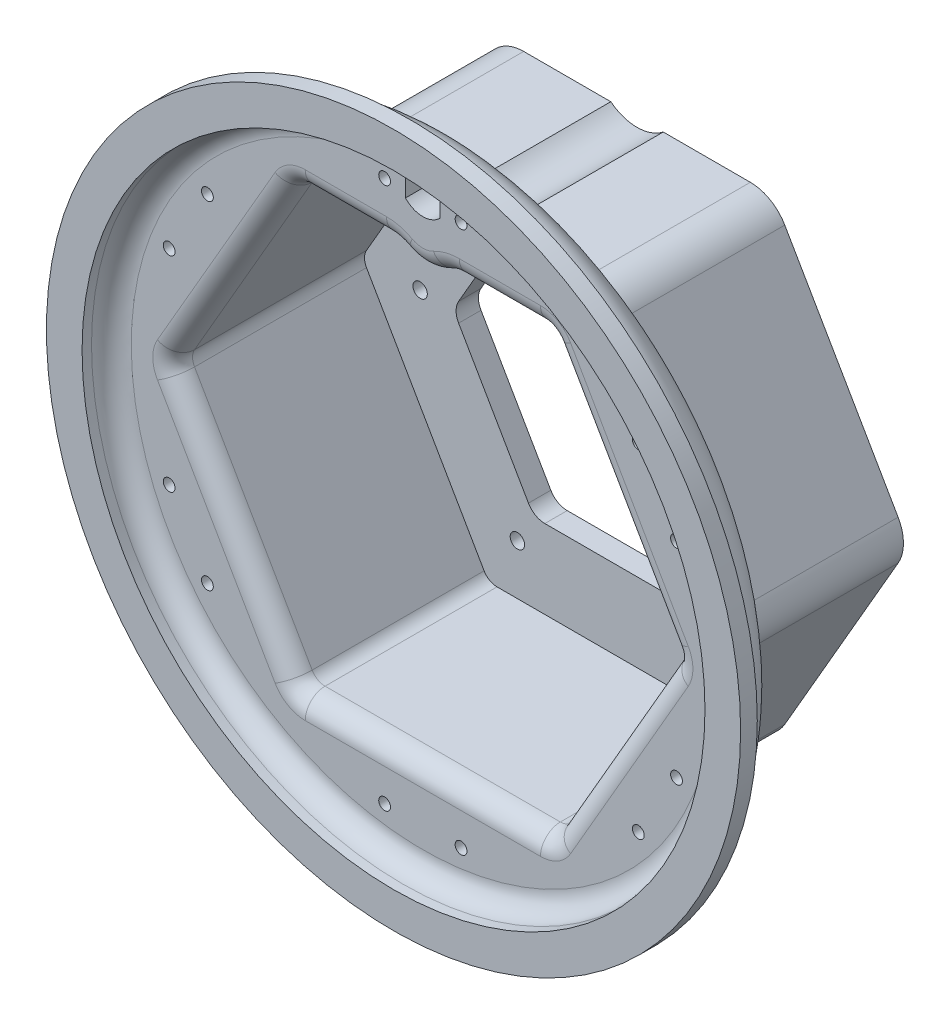
from build123d import *

# Parameters (mm, degrees)
BOSS_EXTRUDE1_DEPTH        = 65
BOSS_EXTRUDE2_START        = 9
BOSS_EXTRUDE2_DEPTH        = 9
SKETCH6_R                  = 132.3
BOSS_EXTRUDE3_DEPTH        = 12.2
CUT_EXTRUDE1_REACH         = 204.402
SKETCH3_R                  = 2.9
FILLET1_R                  = 7.62
FILLET2_R                  = 6
FILLET3_R                  = 14
FILLET6_R                  = 14
SKETCH12_R                 = 131.85493252
SKETCH12_R_2               = 125.35493252
BOSS_EXTRUDE5_DEPTH        = 5.1
SKETCH13_R                 = 139.7
SKETCH13_R_2               = 125.35493252
BOSS_EXTRUDE7_DEPTH        = 6.7
FILLET7_R                  = 8
FILLET8_R                  = 4
FILLET9_R                  = 8
CUT_EXTRUDE2_DEPTH         = 211.969618666
CIRPATTERN1_COUNT          = 6
FILLET11_R                 = 16
FILLET10_R                 = 4
STAR_START                 = -6.477
STAR_HUB_Y_END_OUTLINE_R   = 2.375
STAR_HUB_Y_END_OUTLINE_R_2 = 2.5908
STAR_HUB_Y_END_OUTLINE_R_3 = 14.5288
STAR_HUB_Y_END_DEPTH       = 9.525
BODY_MOVE_COPY2_ANGLE      = 93.8409657
SKETCH18_R                 = 2.375
CUT_EXTRUDE3_DEPTH         = 12.2
CIRPATTERN2_COUNT          = 6


with BuildPart() as part:
    # Sketch1 → Boss-Extrude1 (new body)
    with BuildSketch(Plane.XY):
        with BuildLine():
            Line((109.696551146, 0), (54.848275573, 95))
            Line((54.848275573, 95), (10.560528181, 95))
            ThreePointArc((10.560528181, 95), (0, 91.321983506), (-10.560528181, 95))
            Line((-10.560528181, 95), (-54.848275573, 95))
            Line((-54.848275573, 95), (-109.696551146, 0))
            Line((-109.696551146, 0), (-54.848275573, -95))
            Line((-54.848275573, -95), (54.848275573, -95))
            Line((54.848275573, -95), (109.696551146, 0))
        make_face()
        with BuildLine():
            Line((101.613647377, 0), (50.806823689, 88))
            Line((50.806823689, 88), (10.560528181, 88))
            ThreePointArc((10.560528181, 88), (0, 84.321983506), (-10.560528181, 88))
            Line((-10.560528181, 88), (-50.806823689, 88))
            Line((-50.806823689, 88), (-101.613647377, 0))
            Line((-101.613647377, 0), (-50.806823689, -88))
            Line((-50.806823689, -88), (50.806823689, -88))
            Line((50.806823689, -88), (101.613647377, 0))
        make_face(mode=Mode.SUBTRACT)
    extrude(amount=BOSS_EXTRUDE1_DEPTH)

    # Sketch2 → Boss-Extrude2 (add)
    with BuildSketch(Plane(origin=(0, 0, 0), x_dir=(-1, 0, 0), z_dir=(0, 0, -1)).offset(BOSS_EXTRUDE2_START)):
        with BuildLine():
            Line((109.696551146, 0), (54.848275573, 95))
            Line((54.848275573, 95), (10.560528181, 95))
            ThreePointArc((10.560528181, 95), (0, 91.321983506), (-10.560528181, 95))
            Line((-10.560528181, 95), (-54.848275573, 95))
            Line((-54.848275573, 95), (-109.696551146, 0))
            Line((-109.696551146, 0), (-54.848275573, -95))
            Line((-54.848275573, -95), (54.848275573, -95))
            Line((54.848275573, -95), (109.696551146, 0))
        make_face()
        Polygon((65, 0), (32.5, 56.291651246), (-32.5, 56.291651246), (-65, 0), (-32.5, -56.291651246), (32.5, -56.291651246), align=None, mode=Mode.SUBTRACT)
    extrude(amount=-BOSS_EXTRUDE2_DEPTH)

    # Sketch6 → Boss-Extrude3 (add)
    with BuildSketch(Plane.XY.offset(65)):
        Circle(SKETCH6_R)
        with BuildLine():
            Line((101.613647377, 0), (50.806823689, 88))
            Line((50.806823689, 88), (10.560528181, 88))
            ThreePointArc((10.560528181, 88), (0, 84.321983506), (-10.560528181, 88))
            Line((-10.560528181, 88), (-50.806823689, 88))
            Line((-50.806823689, 88), (-101.613647377, 0))
            Line((-101.613647377, 0), (-50.806823689, -88))
            Line((-50.806823689, -88), (50.806823689, -88))
            Line((50.806823689, -88), (101.613647377, 0))
        make_face(mode=Mode.SUBTRACT)
    extrude(amount=BOSS_EXTRUDE3_DEPTH)

    # Sketch3 → Cut-Extrude1 (cut, up to next)
    with BuildSketch(Plane.XY, mode=Mode.PRIVATE) as cut_extrude1_sk1:
        with Locations((78.3, 0)):
            Circle(SKETCH3_R)
    cut_extrude1_tool1 = extrude(cut_extrude1_sk1.sketch, amount=-CUT_EXTRUDE1_REACH, mode=Mode.PRIVATE) & part.part
    cut_extrude1 = cut_extrude1_tool1.solids().sort_by_distance((78.3, 0, 0))[0]
    add(cut_extrude1, mode=Mode.SUBTRACT)

    # Fillet1
    fillet1_edges = [part.edges().sort_by_distance(p)[0] for p in [
        (-65, 0, -4.5),
        (-32.5, 56.291651246, -4.5),
        (32.5, 56.291651246, -4.5),
        (65, 0, -4.5),
        (32.5, -56.291651246, -4.5),
        (-32.5, -56.291651246, -4.5),
    ]]
    fillet(fillet1_edges, radius=FILLET1_R)

    # Fillet2
    fillet2_edges = [part.edges().sort_by_distance(p)[0] for p in [
        (50.806823689, -88, 38.6),
        (101.613647377, 0, 38.6),
        (50.806823689, 88, 38.6),
        (-50.806823689, 88, 38.6),
        (-101.613647377, 0, 38.6),
        (-50.806823689, -88, 38.6),
    ]]
    fillet(fillet2_edges, radius=FILLET2_R)

    # Fillet3
    fillet3_edges = [part.edges().sort_by_distance(p)[0] for p in [
        (10.560528181, 88, 38.6),
        (-10.560528181, 88, 38.6),
    ]]
    fillet(fillet3_edges, radius=FILLET3_R)

    # Fillet6
    # the kernel refuses this fillet: 14 mm, written as the material it takes off along each edge
    with BuildSketch(Plane(origin=(0, 0, 65), x_dir=(1, 0, 0), z_dir=(0, -1, 0))) as fillet6_piece_1:
        with BuildLine():
            CenterArc((118.416196487, 14), FILLET6_R, 270, 82.612951564)
            Line((118.416196487, 0), (118.416196487, -0.28))
            Line((118.416196487, -0.28), (132.3, -0.28))
            Line((132.3, -0.28), (132.58, 0))
            ThreePointArc((132.58, 0), (132.58, 6.1), (132.57767607, 12.164))
            Line((132.57767607, 12.164), (132.3, 12.2))
        make_face()
    revolve(axis=Axis((0, 0, 65), (0, 0, 1)), mode=Mode.SUBTRACT)

    # Sketch12 → Boss-Extrude5 (add)
    with BuildSketch(Plane.XY.offset(77.2)):
        Circle(SKETCH12_R)
        Circle(SKETCH12_R_2, mode=Mode.SUBTRACT)
    extrude(amount=BOSS_EXTRUDE5_DEPTH)

    # Sketch13 → Boss-Extrude7 (add)
    with BuildSketch(Plane.XY.offset(82.3)):
        Circle(SKETCH13_R)
        Circle(SKETCH13_R_2, mode=Mode.SUBTRACT)
    extrude(amount=BOSS_EXTRUDE7_DEPTH)

    # Fillet7
    fillet7_edges = [part.edges().sort_by_distance(p)[0] for p in [
        (-125.35493252, 0, 77.2),
    ]]
    fillet(fillet7_edges, radius=FILLET7_R)

    # Fillet8
    fillet8_edges = [part.edges().sort_by_distance(p)[0] for p in [
        (-131.85493252, 0, 82.3),
    ]]
    fillet(fillet8_edges, radius=FILLET8_R)

    # Fillet9
    fillet9_edges = [part.edges().sort_by_distance(p)[0] for p in [
        (-76.210235533, -44, 77.2),
        (0, -88, 77.2),
        (76.210235533, -44, 77.2),
        (76.210235533, 44, 77.2),
        (30.994427629, 88, 77.2),
        (-76.210235533, 44, 77.2),
        (-50.342722074, -87.196152423, 77.2),
        (50.342722074, -87.196152423, 77.2),
        (100.685444147, 0, 77.2),
        (50.342722074, 87.196152423, 77.2),
        (-50.342722074, 87.196152423, 77.2),
        (-100.685444147, 0, 77.2),
        (0, 84.321983506, 77.2),
        (-30.994427629, 88, 77.2),
        (11.236253723, 87.578391733, 77.2),
        (-11.236253723, 87.578391733, 77.2),
    ]]
    fillet(fillet9_edges, radius=FILLET9_R)

    # Sketch9 → Cut-Extrude2 (cut, through all)
    with BuildSketch(Plane(origin=(0, 0, 65), x_dir=(-1, 0, 0), z_dir=(0, 0, -1))):
        with BuildLine():
            Line((7, 106.321983506), (7, 119.321983506))
            ThreePointArc((7, 119.321983506), (0, 122.321983506), (-7, 119.321983506))
            Line((-7, 119.321983506), (-7, 106.321983506))
            ThreePointArc((-7, 106.321983506), (0, 103.321983506), (7, 106.321983506))
        make_face()
    extrude(amount=-CUT_EXTRUDE2_DEPTH, mode=Mode.SUBTRACT)

    # CirPattern1: Cut-Extrude1 ×6 about axis
    cirpattern1_axis = Axis((0, 0, 0), (0, 0, 1))
    for i in range(1, CIRPATTERN1_COUNT):
        add(cut_extrude1.rotate(cirpattern1_axis, i * 360 / CIRPATTERN1_COUNT), mode=Mode.SUBTRACT)

    # Fillet11
    fillet11_edges = [part.edges().sort_by_distance(p)[0] for p in [
        (54.848275573, -95, 28),
        (-54.848275573, -95, 28),
        (-109.696551146, 0, 28),
        (-54.848275573, 95, 28),
        (54.848275573, 95, 28),
        (109.696551146, 0, 28),
    ]]
    fillet(fillet11_edges, radius=FILLET11_R)

    # Fillet10
    fillet10_edges = [part.edges().sort_by_distance(p)[0] for p in [
        (0, 91.321983506, 65),
        (-28.085599723, 95, 65),
        (-82.27241336, -47.5, 65),
        (-82.27241336, 47.5, 65),
        (28.085599723, 95, 65),
        (82.27241336, 47.5, 65),
        (82.27241336, -47.5, 65),
        (0, -95, 65),
        (-107.221342532, 0, 65),
        (-53.610671266, 92.856406461, 65),
        (53.610671266, 92.856406461, 65),
        (107.221342532, 0, 65),
        (53.610671266, -92.856406461, 65),
        (-53.610671266, -92.856406461, 65),
    ]]
    fillet(fillet10_edges, radius=FILLET10_R)

    # Sketch18 → Cut-Extrude3 (cut)
    with BuildSketch(Plane(origin=(0, 0, 65), x_dir=(-1, 0, 0), z_dir=(0, 0, -1))):
        with Locations((-15.376952006, 109.00535553)):
            Circle(SKETCH18_R)
        with Locations((15.376952006, 109.00535553)):
            Circle(SKETCH18_R)
    cut_extrude3 = extrude(amount=-CUT_EXTRUDE3_DEPTH, mode=Mode.SUBTRACT)

    # CirPattern2: Cut-Extrude3 ×6 about axis
    cirpattern2_axis = Axis((0, 0, 0), (0, 0, 1))
    for i in range(1, CIRPATTERN2_COUNT):
        add(cut_extrude3.rotate(cirpattern2_axis, i * 360 / CIRPATTERN2_COUNT), mode=Mode.SUBTRACT)


with BuildPart() as body_2:
    # Star Hub Y end: read off the stored shape, not the designer's step
    # Star Hub Y end outline → Star Hub Y end (new body)
    with BuildSketch(Plane(origin=(0, 0, 0), x_dir=(1, 0, 0), z_dir=(0, 1, 0)).offset(STAR_START)):
        with BuildLine():
            Line((107.56890983, 20.737840341), (72.569009092, 11.359645204))
            ThreePointArc((72.569009092, 11.359645204), (71.591417553, 11.165190156), (70.596807968, 11.1))
            Line((70.596807968, 11.1), (32.665578213, 11.1))
            ThreePointArc((32.665578213, 11.1), (25.817851007, 14.905943229), (25.945671089, 22.739220562))
            Line((25.945671089, 22.739220562), (44.911285966, 55.588629127))
            ThreePointArc((44.911285966, 55.588629127), (45.46504709, 56.417391216), (46.12224587, 57.166782799))
            Line((46.12224587, 57.166782799), (71.74395147, 82.788488399))
            ThreePointArc((71.74395147, 82.788488399), (71.74395147, 90.63737367), (63.895066199, 90.63737367))
            Line((63.895066199, 90.63737367), (56.639534627, 83.381842098))
            ThreePointArc((56.639534627, 83.381842098), (47.441380954, 82.170882194), (43.891026158, 90.742196895))
            Line((43.891026158, 90.742196895), (46.546735031, 100.65343734))
            ThreePointArc((46.546735031, 100.65343734), (42.622292395, 107.450771376), (35.824958359, 103.526328741))
            Line((35.824958359, 103.526328741), (26.446763222, 68.526428003))
            ThreePointArc((26.446763222, 68.526428003), (26.126370463, 67.582581372), (25.685522002, 66.688629127))
            Line((25.685522002, 66.688629127), (6.719907125, 33.839220562))
            ThreePointArc((6.719907125, 33.839220562), (0, 29.811886457), (-6.719907125, 33.839220562))
            Line((-6.719907125, 33.839220562), (-25.685522002, 66.688629127))
            ThreePointArc((-25.685522002, 66.688629127), (-26.126370463, 67.582581372), (-26.446763222, 68.526428003))
            Line((-26.446763222, 68.526428003), (-35.824958359, 103.526328741))
            ThreePointArc((-35.824958359, 103.526328741), (-42.622292395, 107.450771376), (-46.546735031, 100.65343734))
            Line((-46.546735031, 100.65343734), (-43.891026158, 90.742196895))
            ThreePointArc((-43.891026158, 90.742196895), (-47.441380954, 82.170882194), (-56.639534627, 83.381842098))
            Line((-56.639534627, 83.381842098), (-63.895066199, 90.63737367))
            ThreePointArc((-63.895066199, 90.63737367), (-71.74395147, 90.63737367), (-71.74395147, 82.788488399))
            Line((-71.74395147, 82.788488399), (-46.12224587, 57.166782799))
            ThreePointArc((-46.12224587, 57.166782799), (-45.46504709, 56.417391216), (-44.911285966, 55.588629127))
            Line((-44.911285966, 55.588629127), (-25.945671089, 22.739220562))
            ThreePointArc((-25.945671089, 22.739220562), (-25.817851007, 14.905943229), (-32.665578213, 11.1))
            Line((-32.665578213, 11.1), (-70.596807968, 11.1))
            ThreePointArc((-70.596807968, 11.1), (-71.591417553, 11.165190156), (-72.569009092, 11.359645204))
            Line((-72.569009092, 11.359645204), (-107.56890983, 20.737840341))
            ThreePointArc((-107.56890983, 20.737840341), (-114.366243866, 16.813397706), (-110.44180123, 10.01606367))
            Line((-110.44180123, 10.01606367), (-100.530560785, 7.360354796))
            ThreePointArc((-100.530560785, 7.360354796), (-94.882761909, 0), (-100.530560785, -7.360354796))
            Line((-100.530560785, -7.360354796), (-110.44180123, -10.01606367))
            ThreePointArc((-110.44180123, -10.01606367), (-114.366243866, -16.813397706), (-107.56890983, -20.737840341))
            Line((-107.56890983, -20.737840341), (-72.569009092, -11.359645204))
            ThreePointArc((-72.569009092, -11.359645204), (-71.591417553, -11.165190156), (-70.596807968, -11.1))
            Line((-70.596807968, -11.1), (-32.665578213, -11.1))
            ThreePointArc((-32.665578213, -11.1), (-25.817851007, -14.905943229), (-25.945671089, -22.739220562))
            Line((-25.945671089, -22.739220562), (-44.911285966, -55.588629127))
            ThreePointArc((-44.911285966, -55.588629127), (-45.46504709, -56.417391216), (-46.12224587, -57.166782799))
            Line((-46.12224587, -57.166782799), (-71.74395147, -82.788488399))
            ThreePointArc((-71.74395147, -82.788488399), (-71.74395147, -90.63737367), (-63.895066199, -90.63737367))
            Line((-63.895066199, -90.63737367), (-56.639534627, -83.381842098))
            ThreePointArc((-56.639534627, -83.381842098), (-47.441380954, -82.170882194), (-43.891026158, -90.742196895))
            Line((-43.891026158, -90.742196895), (-46.546735031, -100.65343734))
            ThreePointArc((-46.546735031, -100.65343734), (-42.622292395, -107.450771376), (-35.824958359, -103.526328741))
            Line((-35.824958359, -103.526328741), (-26.446763222, -68.526428003))
            ThreePointArc((-26.446763222, -68.526428003), (-26.126370463, -67.582581372), (-25.685522002, -66.688629127))
            Line((-25.685522002, -66.688629127), (-6.719907125, -33.839220562))
            ThreePointArc((-6.719907125, -33.839220562), (0, -29.811886457), (6.719907125, -33.839220562))
            Line((6.719907125, -33.839220562), (25.685522002, -66.688629127))
            ThreePointArc((25.685522002, -66.688629127), (26.126370463, -67.582581372), (26.446763222, -68.526428003))
            Line((26.446763222, -68.526428003), (35.824958359, -103.526328741))
            ThreePointArc((35.824958359, -103.526328741), (42.622292395, -107.450771376), (46.546735031, -100.65343734))
            Line((46.546735031, -100.65343734), (43.891026158, -90.742196895))
            ThreePointArc((43.891026158, -90.742196895), (47.441380954, -82.170882194), (56.639534627, -83.381842098))
            Line((56.639534627, -83.381842098), (63.895066199, -90.63737367))
            ThreePointArc((63.895066199, -90.63737367), (71.74395147, -90.63737367), (71.74395147, -82.788488399))
            Line((71.74395147, -82.788488399), (46.12224587, -57.166782799))
            ThreePointArc((46.12224587, -57.166782799), (45.46504709, -56.417391216), (44.911285966, -55.588629127))
            Line((44.911285966, -55.588629127), (25.945671089, -22.739220562))
            ThreePointArc((25.945671089, -22.739220562), (25.817851007, -14.905943229), (32.665578213, -11.1))
            Line((32.665578213, -11.1), (70.596807968, -11.1))
            ThreePointArc((70.596807968, -11.1), (71.591417553, -11.165190156), (72.569009092, -11.359645204))
            Line((72.569009092, -11.359645204), (107.56890983, -20.737840341))
            ThreePointArc((107.56890983, -20.737840341), (114.366243866, -16.813397706), (110.44180123, -10.01606367))
            Line((110.44180123, -10.01606367), (100.530560785, -7.360354796))
            ThreePointArc((100.530560785, -7.360354796), (94.882761909, 0), (100.530560785, 7.360354796))
            Line((100.530560785, 7.360354796), (110.44180123, 10.01606367))
            ThreePointArc((110.44180123, 10.01606367), (114.366243866, 16.813397706), (107.56890983, 20.737840341))
        make_face()
        with Locations((-67.819508835, -86.712931035)):
            Circle(STAR_HUB_Y_END_OUTLINE_R, mode=Mode.SUBTRACT)
        with Locations((-41.185846695, -102.08988304)):
            Circle(STAR_HUB_Y_END_OUTLINE_R, mode=Mode.SUBTRACT)
        with Locations((-109.00535553, -15.376952006)):
            Circle(STAR_HUB_Y_END_OUTLINE_R, mode=Mode.SUBTRACT)
        with BuildLine():
            Line((-43.277243206, -75.568384044), (-43.805518702, -75.263384044))
            ThreePointArc((-43.805518702, -75.263384044), (-47.355873499, -70.636471591), (-46.594632279, -64.854270468))
            Line((-46.594632279, -64.854270468), (-27.774901325, -32.25754027))
            ThreePointArc((-27.774901325, -32.25754027), (-23.147988872, -28.707185474), (-17.365787748, -29.468426693))
            Line((-17.365787748, -29.468426693), (-16.837512252, -29.773426693))
            ThreePointArc((-16.837512252, -29.773426693), (-13.287157456, -34.400339146), (-14.048398675, -40.18254027))
            Line((-14.048398675, -40.18254027), (-32.868129629, -72.779270468))
            ThreePointArc((-32.868129629, -72.779270468), (-37.495042082, -76.329625264), (-43.277243206, -75.568384044))
        make_face(mode=Mode.SUBTRACT)
        with Locations((-11.90625, -20.622229928)):
            Circle(STAR_HUB_Y_END_OUTLINE_R_2, mode=Mode.SUBTRACT)
        with Locations((41.185846695, -102.08988304)):
            Circle(STAR_HUB_Y_END_OUTLINE_R, mode=Mode.SUBTRACT)
        with Locations((67.819508835, -86.712931035)):
            Circle(STAR_HUB_Y_END_OUTLINE_R, mode=Mode.SUBTRACT)
        with BuildLine():
            Line((43.805518702, -75.263384044), (43.277243206, -75.568384044))
            ThreePointArc((43.277243206, -75.568384044), (37.495042082, -76.329625264), (32.868129629, -72.779270468))
            Line((32.868129629, -72.779270468), (14.048398675, -40.18254027))
            ThreePointArc((14.048398675, -40.18254027), (13.287157456, -34.400339146), (16.837512252, -29.773426693))
            Line((16.837512252, -29.773426693), (17.365787748, -29.468426693))
            ThreePointArc((17.365787748, -29.468426693), (23.147988872, -28.707185474), (27.774901325, -32.25754027))
            Line((27.774901325, -32.25754027), (46.594632279, -64.854270468))
            ThreePointArc((46.594632279, -64.854270468), (47.355873499, -70.636471591), (43.805518702, -75.263384044))
        make_face(mode=Mode.SUBTRACT)
        with Locations((11.90625, -20.622229928)):
            Circle(STAR_HUB_Y_END_OUTLINE_R_2, mode=Mode.SUBTRACT)
        with Locations((109.00535553, -15.376952006)):
            Circle(STAR_HUB_Y_END_OUTLINE_R, mode=Mode.SUBTRACT)
        with Locations((-109.00535553, 15.376952006)):
            Circle(STAR_HUB_Y_END_OUTLINE_R, mode=Mode.SUBTRACT)
        with BuildLine():
            Line((-87.082761909, -0.305), (-87.082761909, 0.305))
            ThreePointArc((-87.082761909, 0.305), (-84.850915581, 5.693153673), (-79.462761909, 7.925))
            Line((-79.462761909, 7.925), (-41.8233, 7.925))
            ThreePointArc((-41.8233, 7.925), (-36.435146327, 5.693153673), (-34.2033, 0.305))
            Line((-34.2033, 0.305), (-34.2033, -0.305))
            ThreePointArc((-34.2033, -0.305), (-36.435146327, -5.693153673), (-41.8233, -7.925))
            Line((-41.8233, -7.925), (-79.462761909, -7.925))
            ThreePointArc((-79.462761909, -7.925), (-84.850915581, -5.693153673), (-87.082761909, -0.305))
        make_face(mode=Mode.SUBTRACT)
        with Locations((-23.8125, 0)):
            Circle(STAR_HUB_Y_END_OUTLINE_R_2, mode=Mode.SUBTRACT)
        with Locations((-11.90625, 20.622229928)):
            Circle(STAR_HUB_Y_END_OUTLINE_R_2, mode=Mode.SUBTRACT)
        with BuildLine():
            Line((-43.805518702, 75.263384044), (-43.277243206, 75.568384044))
            ThreePointArc((-43.277243206, 75.568384044), (-37.495042082, 76.329625264), (-32.868129629, 72.779270468))
            Line((-32.868129629, 72.779270468), (-14.048398675, 40.18254027))
            ThreePointArc((-14.048398675, 40.18254027), (-13.287157456, 34.400339146), (-16.837512252, 29.773426693))
            Line((-16.837512252, 29.773426693), (-17.365787748, 29.468426693))
            ThreePointArc((-17.365787748, 29.468426693), (-23.147988872, 28.707185474), (-27.774901325, 32.25754027))
            Line((-27.774901325, 32.25754027), (-46.594632279, 64.854270468))
            ThreePointArc((-46.594632279, 64.854270468), (-47.355873499, 70.636471591), (-43.805518702, 75.263384044))
        make_face(mode=Mode.SUBTRACT)
        with Locations((-67.819508835, 86.712931035)):
            Circle(STAR_HUB_Y_END_OUTLINE_R, mode=Mode.SUBTRACT)
        with Locations((-41.185846695, 102.08988304)):
            Circle(STAR_HUB_Y_END_OUTLINE_R, mode=Mode.SUBTRACT)
        Circle(STAR_HUB_Y_END_OUTLINE_R_3, mode=Mode.SUBTRACT)
        with Locations((23.8125, 0)):
            Circle(STAR_HUB_Y_END_OUTLINE_R_2, mode=Mode.SUBTRACT)
        with Locations((11.90625, 20.622229928)):
            Circle(STAR_HUB_Y_END_OUTLINE_R_2, mode=Mode.SUBTRACT)
        with BuildLine():
            Line((43.277243206, 75.568384044), (43.805518702, 75.263384044))
            ThreePointArc((43.805518702, 75.263384044), (47.355873499, 70.636471591), (46.594632279, 64.854270468))
            Line((46.594632279, 64.854270468), (27.774901325, 32.25754027))
            ThreePointArc((27.774901325, 32.25754027), (23.147988872, 28.707185474), (17.365787748, 29.468426693))
            Line((17.365787748, 29.468426693), (16.837512252, 29.773426693))
            ThreePointArc((16.837512252, 29.773426693), (13.287157456, 34.400339146), (14.048398675, 40.18254027))
            Line((14.048398675, 40.18254027), (32.868129629, 72.779270468))
            ThreePointArc((32.868129629, 72.779270468), (37.495042082, 76.329625264), (43.277243206, 75.568384044))
        make_face(mode=Mode.SUBTRACT)
        with BuildLine():
            Line((87.082761909, 0.305), (87.082761909, -0.305))
            ThreePointArc((87.082761909, -0.305), (84.850915581, -5.693153673), (79.462761909, -7.925))
            Line((79.462761909, -7.925), (41.8233, -7.925))
            ThreePointArc((41.8233, -7.925), (36.435146327, -5.693153673), (34.2033, -0.305))
            Line((34.2033, -0.305), (34.2033, 0.305))
            ThreePointArc((34.2033, 0.305), (36.435146327, 5.693153673), (41.8233, 7.925))
            Line((41.8233, 7.925), (79.462761909, 7.925))
            ThreePointArc((79.462761909, 7.925), (84.850915581, 5.693153673), (87.082761909, 0.305))
        make_face(mode=Mode.SUBTRACT)
        with Locations((109.00535553, 15.376952006)):
            Circle(STAR_HUB_Y_END_OUTLINE_R, mode=Mode.SUBTRACT)
        with Locations((41.185846695, 102.08988304)):
            Circle(STAR_HUB_Y_END_OUTLINE_R, mode=Mode.SUBTRACT)
        with Locations((67.819508835, 86.712931035)):
            Circle(STAR_HUB_Y_END_OUTLINE_R, mode=Mode.SUBTRACT)
    extrude(amount=STAR_HUB_Y_END_DEPTH)


with BuildPart() as body_2_1:
    # Body-Move/Copy2: read off the stored shape, not the designer's step
    # Body-Move/Copy2: moved
    add(body_2.part.moved(Location((0, -3.048, 0))).rotate(Axis((0, 0, 0), (-0.9351131265, 0.2505628071, -0.2505628071)), BODY_MOVE_COPY2_ANGLE))


solid = part.part
